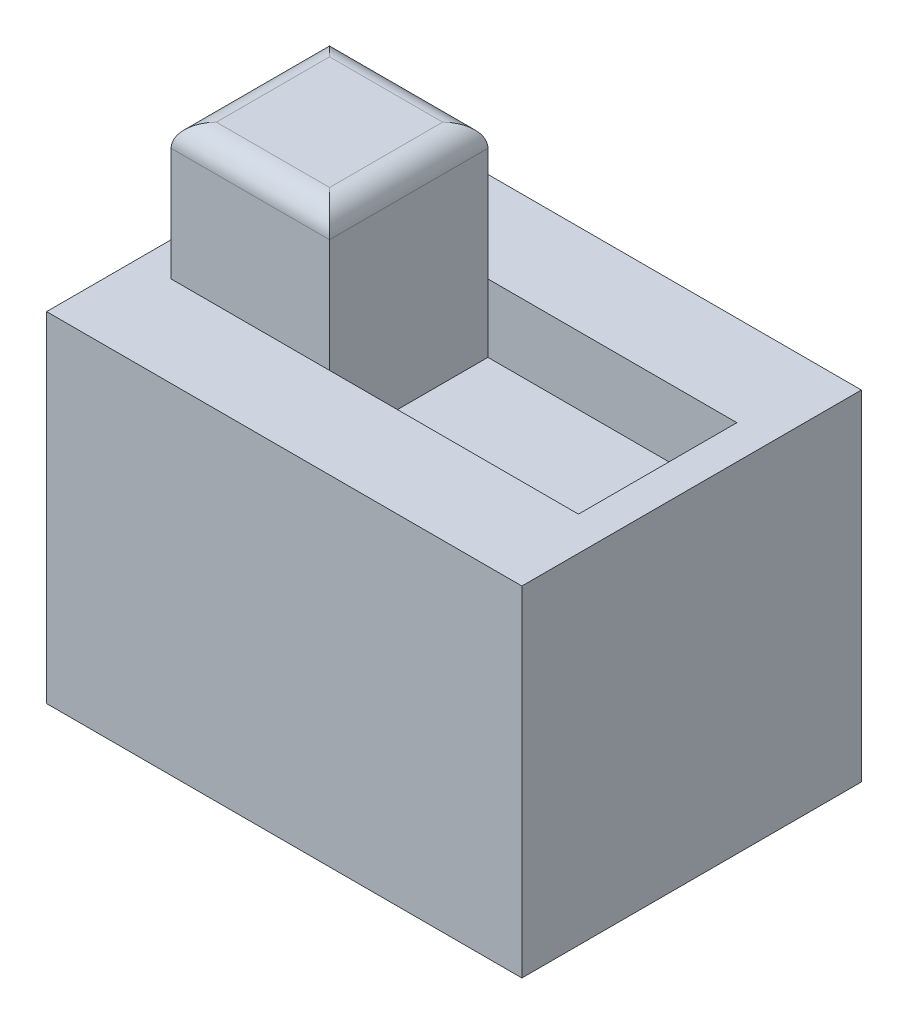
from build123d import *

# Parameters (mm, degrees)
SKETCH1_W           = 21
SKETCH1_H           = 15
BOSS_EXTRUDE1_DEPTH = 15
SKETCH3_W           = 18
SKETCH3_H           = 7
CUT_EXTRUDE1_DEPTH  = 3
SKETCH4_W           = 7
SKETCH4_H           = 7
BOSS_EXTRUDE3_DEPTH = 9
FILLET2_R           = 1


with BuildPart() as part:
    # Sketch1 → Boss-Extrude1 (new body)
    with BuildSketch(Plane(origin=(0, 0, 0), x_dir=(1, 0, 0), z_dir=(0, 1, 0))):
        Rectangle(SKETCH1_W, SKETCH1_H)
    extrude(amount=BOSS_EXTRUDE1_DEPTH)

    # Sketch3 → Cut-Extrude1 (cut)
    with BuildSketch(Plane(origin=(0, 15, 0), x_dir=(1, 0, 0), z_dir=(0, 1, 0))):
        Rectangle(SKETCH3_W, SKETCH3_H)
    extrude(amount=-CUT_EXTRUDE1_DEPTH, mode=Mode.SUBTRACT)

    # Sketch4 → Boss-Extrude3 (add)
    with BuildSketch(Plane(origin=(0, 12, 0), x_dir=(1, 0, 0), z_dir=(0, 1, 0))):
        with Locations((-5.5, 0)):
            Rectangle(SKETCH4_W, SKETCH4_H)
    extrude(amount=BOSS_EXTRUDE3_DEPTH)

    # Fillet2
    fillet2_edges = [part.edges().sort_by_distance(p)[0] for p in [
        (-5.5, 21, -3.5),
        (-2, 21, 0),
        (-5.5, 21, 3.5),
        (-9, 21, 0),
    ]]
    fillet(fillet2_edges, radius=FILLET2_R)


solid = part.part
